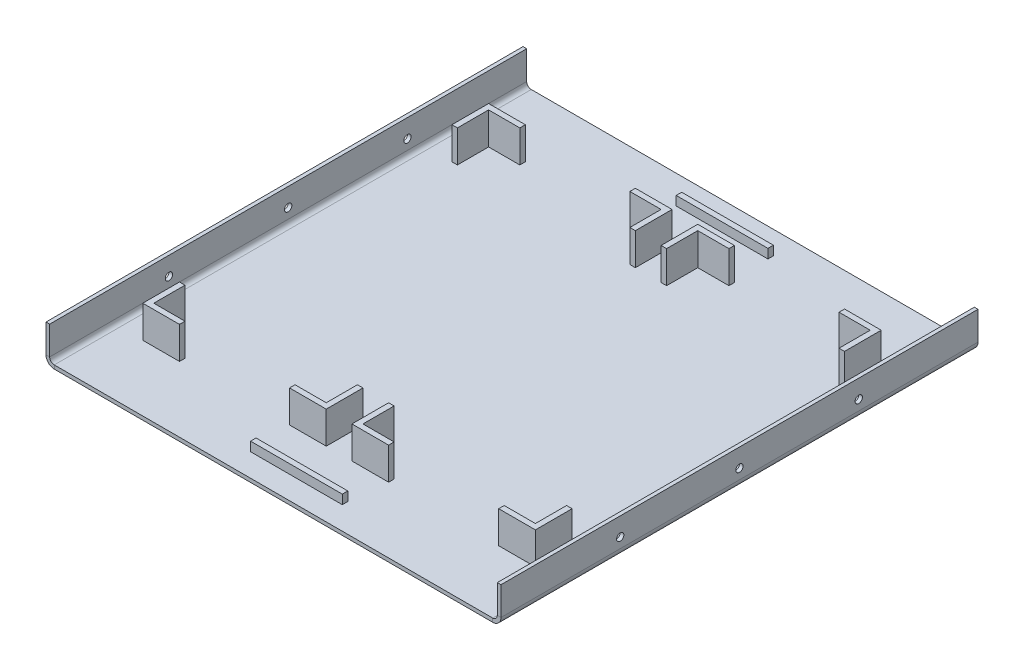
from build123d import *

# Parameters (mm, degrees)
SKETCH1_W                    = 496
SKETCH1_H                    = 520
BOSS_EXTRUDE1_DEPTH          = 4
EDGE_FLANGE1_STRIP_W         = 26
EDGE_FLANGE1_STRIP_H         = 4
EDGE_FLANGE1_STRIP_CUT_DEPTH = 520
EDGE_FLANGE1_DEPTH           = 520
EDGE_FLANGE2_STRIP_W         = 26
EDGE_FLANGE2_STRIP_H         = 4
EDGE_FLANGE2_STRIP_CUT_DEPTH = 520
EDGE_FLANGE2_DEPTH           = 520
CUT_EXTRUDE1_REACH           = 721.733
SKETCH17_R                   = 4
CUT_EXTRUDE2_REACH           = 721.733
SKETCH19_R                   = 4
BOSS_EXTRUDE2_DEPTH          = 35
SKETCH21_W                   = 100
SKETCH21_H                   = 6
BOSS_EXTRUDE3_DEPTH          = 10


# Sheet-metal steps are written as plain solids
with BuildPart() as part:
    # Sketch1 → Boss-Extrude1 (new body)
    with BuildSketch(Plane(origin=(0, 0, 0), x_dir=(1, 0, 0), z_dir=(0, 1, 0))):
        with Locations((248, 260)):
            Rectangle(SKETCH1_W, SKETCH1_H)
    extrude(amount=BOSS_EXTRUDE1_DEPTH)

    # Edge-Flange1 strip (across the edge) → Edge-Flange1 strip cut (cut)
    with BuildSketch(Plane(origin=(0, 4, -520), x_dir=(1, 0, 0), z_dir=(0, 0, 1))):
        with Locations((-4, -2)):
            Rectangle(EDGE_FLANGE1_STRIP_W, EDGE_FLANGE1_STRIP_H)
    extrude(amount=EDGE_FLANGE1_STRIP_CUT_DEPTH, mode=Mode.SUBTRACT)

    # Edge-Flange1 section (across the edge) → Edge-Flange1 (add)
    with BuildSketch(Plane(origin=(0, 4, -520), x_dir=(1, 0, 0), z_dir=(0, 0, 1))):
        with BuildLine():
            Line((0, 5), (0, 36))
            Line((0, 36), (4, 36))
            Line((4, 36), (4, 5))
            ThreePointArc((4, 5), (5.464466094, 1.464466094), (9, 0))
            Line((9, 0), (9, -4))
            ThreePointArc((9, -4), (2.636038969, -1.363961031), (0, 5))
        make_face()
    extrude(amount=EDGE_FLANGE1_DEPTH)

    # Edge-Flange2 strip (across the edge) → Edge-Flange2 strip cut (cut)
    with BuildSketch(Plane(origin=(496, 4, 0), x_dir=(-1, 0, 0), z_dir=(0, 0, -1))):
        with Locations((-4, -2)):
            Rectangle(EDGE_FLANGE2_STRIP_W, EDGE_FLANGE2_STRIP_H)
    extrude(amount=EDGE_FLANGE2_STRIP_CUT_DEPTH, mode=Mode.SUBTRACT)

    # Edge-Flange2 section (across the edge) → Edge-Flange2 (add)
    with BuildSketch(Plane(origin=(496, 4, 0), x_dir=(-1, 0, 0), z_dir=(0, 0, -1))):
        with BuildLine():
            Line((0, 5), (0, 36))
            Line((0, 36), (4, 36))
            Line((4, 36), (4, 5))
            ThreePointArc((4, 5), (5.464466094, 1.464466094), (9, 0))
            Line((9, 0), (9, -4))
            ThreePointArc((9, -4), (2.636038969, -1.363961031), (0, 5))
        make_face()
    extrude(amount=EDGE_FLANGE2_DEPTH)

    # Sketch17 → Cut-Extrude1 (cut, up to next)
    with BuildSketch(Plane.ZY, mode=Mode.PRIVATE) as cut_extrude1_sk1:
        with Locations(Location((-390, 20, 0), (0, 0, 270))):
            Circle(SKETCH17_R)
    cut_extrude1_tool1 = extrude(cut_extrude1_sk1.sketch, amount=-CUT_EXTRUDE1_REACH, mode=Mode.PRIVATE) & part.part
    # Sketch17 → Cut-Extrude1 (cut, up to next)
    with BuildSketch(Plane.ZY, mode=Mode.PRIVATE) as cut_extrude1_sk2:
        with Locations(Location((-260, 20, 0), (0, 0, 270))):
            Circle(SKETCH17_R)
    cut_extrude1_tool2 = extrude(cut_extrude1_sk2.sketch, amount=-CUT_EXTRUDE1_REACH, mode=Mode.PRIVATE) & part.part
    # Sketch17 → Cut-Extrude1 (cut, up to next)
    with BuildSketch(Plane.ZY, mode=Mode.PRIVATE) as cut_extrude1_sk3:
        with Locations(Location((-130, 20, 0), (0, 0, 270))):
            Circle(SKETCH17_R)
    cut_extrude1_tool3 = extrude(cut_extrude1_sk3.sketch, amount=-CUT_EXTRUDE1_REACH, mode=Mode.PRIVATE) & part.part
    add(cut_extrude1_tool1.solids().sort_by_distance((0, 20, -390))[0], mode=Mode.SUBTRACT)
    add(cut_extrude1_tool2.solids().sort_by_distance((0, 20, -260))[0], mode=Mode.SUBTRACT)
    add(cut_extrude1_tool3.solids().sort_by_distance((0, 20, -130))[0], mode=Mode.SUBTRACT)

    # Sketch19 → Cut-Extrude2 (cut, up to next)
    with BuildSketch(Plane(origin=(496, 0, 0), x_dir=(0, 0, -1), z_dir=(1, 0, 0)), mode=Mode.PRIVATE) as cut_extrude2_sk1:
        with Locations(Location((130, 20, 0), (0, 0, 270))):
            Circle(SKETCH19_R)
    cut_extrude2_tool1 = extrude(cut_extrude2_sk1.sketch, amount=-CUT_EXTRUDE2_REACH, mode=Mode.PRIVATE) & part.part
    # Sketch19 → Cut-Extrude2 (cut, up to next)
    with BuildSketch(Plane(origin=(496, 0, 0), x_dir=(0, 0, -1), z_dir=(1, 0, 0)), mode=Mode.PRIVATE) as cut_extrude2_sk2:
        with Locations(Location((260, 20, 0), (0, 0, 270))):
            Circle(SKETCH19_R)
    cut_extrude2_tool2 = extrude(cut_extrude2_sk2.sketch, amount=-CUT_EXTRUDE2_REACH, mode=Mode.PRIVATE) & part.part
    # Sketch19 → Cut-Extrude2 (cut, up to next)
    with BuildSketch(Plane(origin=(496, 0, 0), x_dir=(0, 0, -1), z_dir=(1, 0, 0)), mode=Mode.PRIVATE) as cut_extrude2_sk3:
        with Locations(Location((390, 20, 0), (0, 0, 270))):
            Circle(SKETCH19_R)
    cut_extrude2_tool3 = extrude(cut_extrude2_sk3.sketch, amount=-CUT_EXTRUDE2_REACH, mode=Mode.PRIVATE) & part.part
    add(cut_extrude2_tool1.solids().sort_by_distance((496, 20, -130))[0], mode=Mode.SUBTRACT)
    add(cut_extrude2_tool2.solids().sort_by_distance((496, 20, -260))[0], mode=Mode.SUBTRACT)
    add(cut_extrude2_tool3.solids().sort_by_distance((496, 20, -390))[0], mode=Mode.SUBTRACT)

    # Sketch20 → Boss-Extrude2 (add)
    with BuildSketch(Plane(origin=(0, 4, 0), x_dir=(1, 0, 0), z_dir=(0, 1, 0))):
        Polygon((34, 448.5), (74, 448.5), (74, 442.5), (40, 442.5), (40, 408.5), (34, 408.5), align=None)
        Polygon((234, 448.5), (194, 448.5), (194, 442.5), (228, 442.5), (228, 408.5), (234, 408.5), align=None)
        Polygon((234, 71.5), (194, 71.5), (194, 77.5), (228, 77.5), (228, 111.5), (234, 111.5), align=None)
        Polygon((34, 71.5), (34, 111.5), (40, 111.5), (40, 77.5), (74, 77.5), (74, 71.5), align=None)
        Polygon((262, 448.5), (302, 448.5), (302, 442.5), (268, 442.5), (268, 408.5), (262, 408.5), align=None)
        Polygon((462, 448.5), (422, 448.5), (422, 442.5), (456, 442.5), (456, 408.5), (462, 408.5), align=None)
        Polygon((262, 71.5), (302, 71.5), (302, 77.5), (268, 77.5), (268, 111.5), (262, 111.5), align=None)
        Polygon((462, 71.5), (462, 111.5), (456, 111.5), (456, 77.5), (422, 77.5), (422, 71.5), align=None)
    extrude(amount=BOSS_EXTRUDE2_DEPTH)

    # Sketch21 → Boss-Extrude3 (add)
    with BuildSketch(Plane(origin=(0, 4, 0), x_dir=(1, 0, 0), z_dir=(0, 1, 0))):
        with Locations((248, 28)):
            Rectangle(SKETCH21_W, SKETCH21_H)
        with Locations((248, 492)):
            Rectangle(SKETCH21_W, SKETCH21_H)
    extrude(amount=BOSS_EXTRUDE3_DEPTH)


solid = part.part
